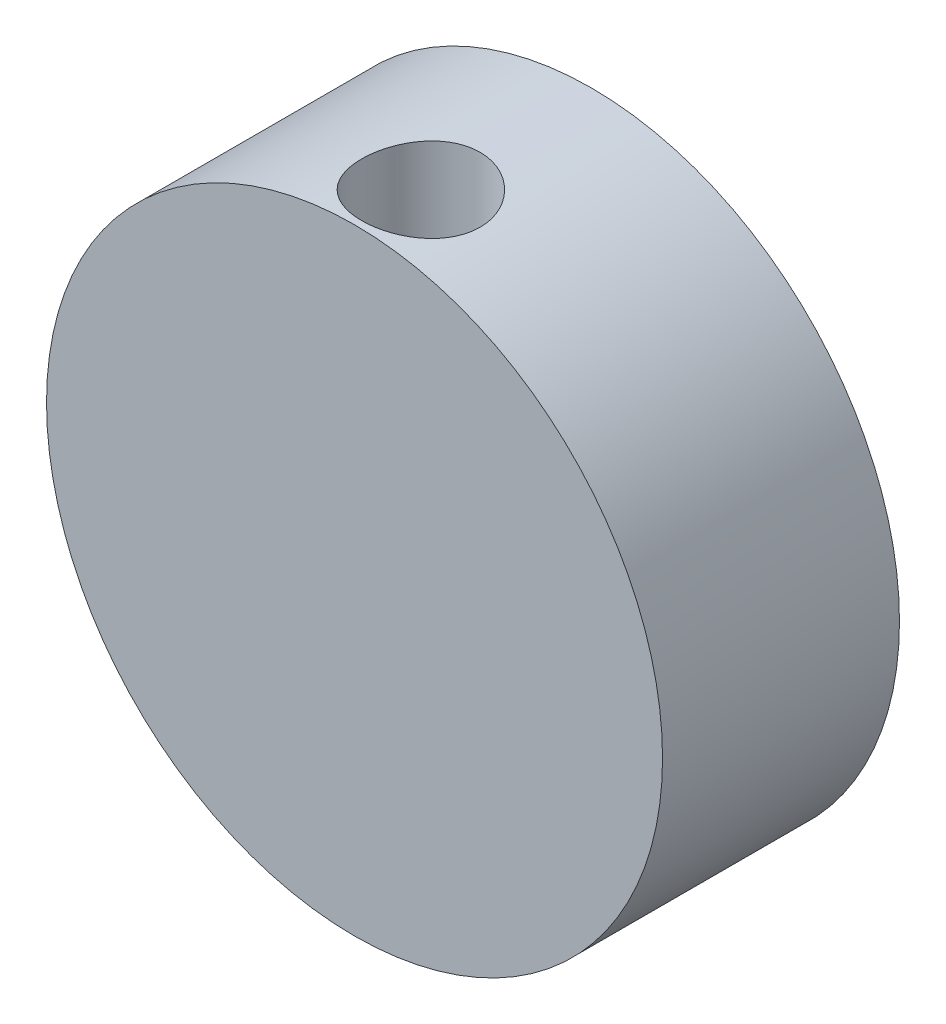
from build123d import *

# Parameters (mm, degrees)
SKETCH1_R           = 65
BOSS_EXTRUDE1_DEPTH = 50
SKETCH4_R           = 12.5
CUT_EXTRUDE3_DEPTH  = 66.5
SKETCH2_R           = 50
CUT_EXTRUDE4_DEPTH  = 10
SKETCH5_R           = 60
CUT_EXTRUDE5_DEPTH  = 10


with BuildPart() as part:
    # Sketch1 → Boss-Extrude1 (new body)
    with BuildSketch(Plane.XY):
        Circle(SKETCH1_R)
    extrude(amount=BOSS_EXTRUDE1_DEPTH)

    # Sketch4 → Cut-Extrude3 (cut, symmetric)
    with BuildSketch(Plane(origin=(0, 0, 0), x_dir=(1, 0, 0), z_dir=(0, 1, 0))):
        with Locations((0, -36)):
            Circle(SKETCH4_R)
    extrude(amount=CUT_EXTRUDE3_DEPTH, both=True, mode=Mode.SUBTRACT)

    # Sketch2 → Cut-Extrude4 (cut)
    with BuildSketch(Plane(origin=(0, 0, 0), x_dir=(-1, 0, 0), z_dir=(0, 0, -1))):
        Circle(SKETCH2_R)
    extrude(amount=-CUT_EXTRUDE4_DEPTH, mode=Mode.SUBTRACT)

    # Sketch5 → Cut-Extrude5 (cut)
    with BuildSketch(Plane(origin=(0, 0, 10), x_dir=(-1, 0, 0), z_dir=(0, 0, -1))):
        Circle(SKETCH5_R)
    extrude(amount=-CUT_EXTRUDE5_DEPTH, mode=Mode.SUBTRACT)


solid = part.part
